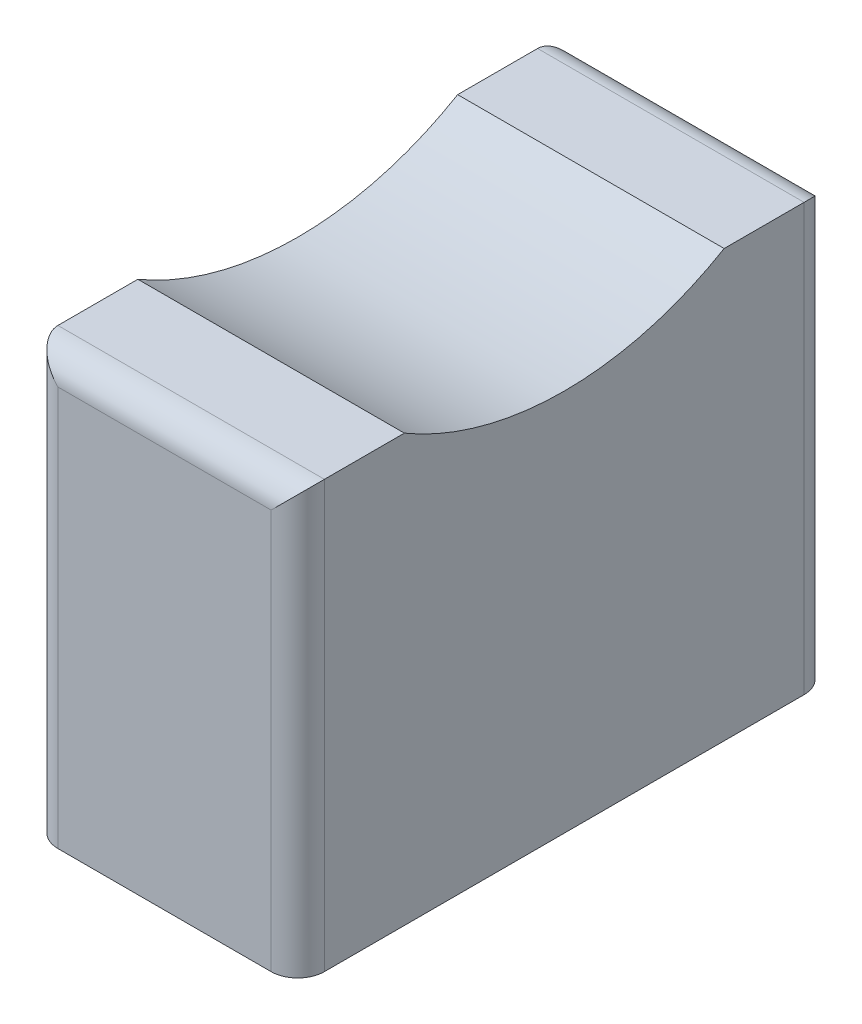
from build123d import *

# Parameters (mm, degrees)
SKETCH1_W           = 10
SKETCH1_H           = 20
BOSS_EXTRUDE1_DEPTH = 16
SKETCH2_W           = 1
SKETCH2_H           = 4
CUT_EXTRUDE1_DEPTH  = 7
CUT_EXTRUDE2_DEPTH  = 10
FILLET2_R           = 1


with BuildPart() as part:
    # Sketch1 → Boss-Extrude1 (new body)
    with BuildSketch(Plane(origin=(0, 0, 0), x_dir=(1, 0, 0), z_dir=(0, 1, 0))):
        Rectangle(SKETCH1_W, SKETCH1_H)
    extrude(amount=BOSS_EXTRUDE1_DEPTH)

    # Sketch2 → Cut-Extrude1 (cut)
    with BuildSketch(Plane.XZ):
        Rectangle(SKETCH2_W, SKETCH2_H)
    extrude(amount=-CUT_EXTRUDE1_DEPTH, mode=Mode.SUBTRACT)

    # Sketch6 → Cut-Extrude2 (cut)
    with BuildSketch(Plane(origin=(5, 0, 0), x_dir=(0, 0, -1), z_dir=(1, 0, 0))):
        with BuildLine():
            Line((-6, 16), (6, 16))
            ThreePointArc((6, 16), (0, 14.36598161), (-6, 16))
        make_face()
    extrude(amount=-CUT_EXTRUDE2_DEPTH, mode=Mode.SUBTRACT)

    # Fillet2
    fillet2_edges = [part.edges().sort_by_distance(p)[0] for p in [
        (0, 16, -10),
        (-5, 8, -10),
        (5, 8, -10),
        (-5, 8, 10),
        (5, 8, 10),
        (0, 16, 10),
    ]]
    fillet(fillet2_edges, radius=FILLET2_R)


solid = part.part
